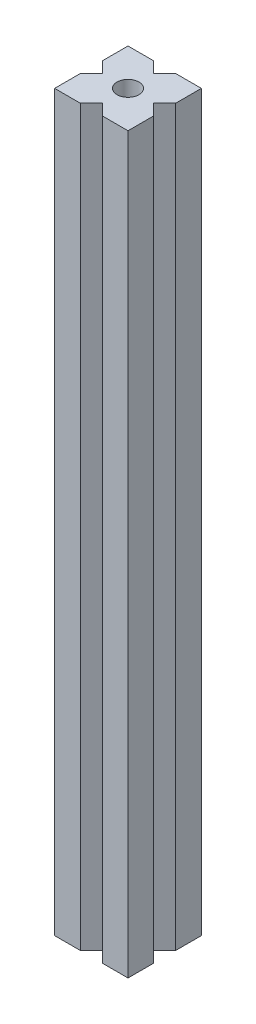
from build123d import *

# Parameters (mm, degrees)
SKIZZE1_W                       = 20
SKIZZE1_H                       = 20
AUFSATZ_LINEAR_AUSTRAGEN1_DEPTH = 200
SCHNITT_LINEAR_AUSTRAGEN1_DEPTH = 202.990098767
SKIZZE3_R                       = 3
SCHNITT_LINEAR_AUSTRAGEN2_DEPTH = 202.990098767


with BuildPart() as part:
    # Skizze1 → Aufsatz-Linear austragen1 (new body)
    with BuildSketch(Plane(origin=(0, 0, 0), x_dir=(1, 0, 0), z_dir=(0, 1, 0))):
        with Locations((10, 10)):
            Rectangle(SKIZZE1_W, SKIZZE1_H)
    extrude(amount=AUFSATZ_LINEAR_AUSTRAGEN1_DEPTH)

    # Skizze2 → Schnitt-Linear austragen1 (cut, through all)
    with BuildSketch(Plane(origin=(0, 200, 0), x_dir=(1, 0, 0), z_dir=(0, 1, 0))):
        Polygon((7, 20), (10, 17), (13, 20), align=None)
        Polygon((20, 13), (17, 10), (20, 7), align=None)
        Polygon((0, 7), (0, 13), (3, 10), align=None)
        Polygon((7, 0), (13, 0), (10, 3), align=None)
    extrude(amount=-SCHNITT_LINEAR_AUSTRAGEN1_DEPTH, mode=Mode.SUBTRACT)

    # Skizze3 → Schnitt-Linear austragen2 (cut, through all)
    with BuildSketch(Plane(origin=(0, 200, 0), x_dir=(1, 0, 0), z_dir=(0, 1, 0))):
        with Locations((10, 10)):
            Circle(SKIZZE3_R)
    extrude(amount=-SCHNITT_LINEAR_AUSTRAGEN2_DEPTH, mode=Mode.SUBTRACT)


solid = part.part
